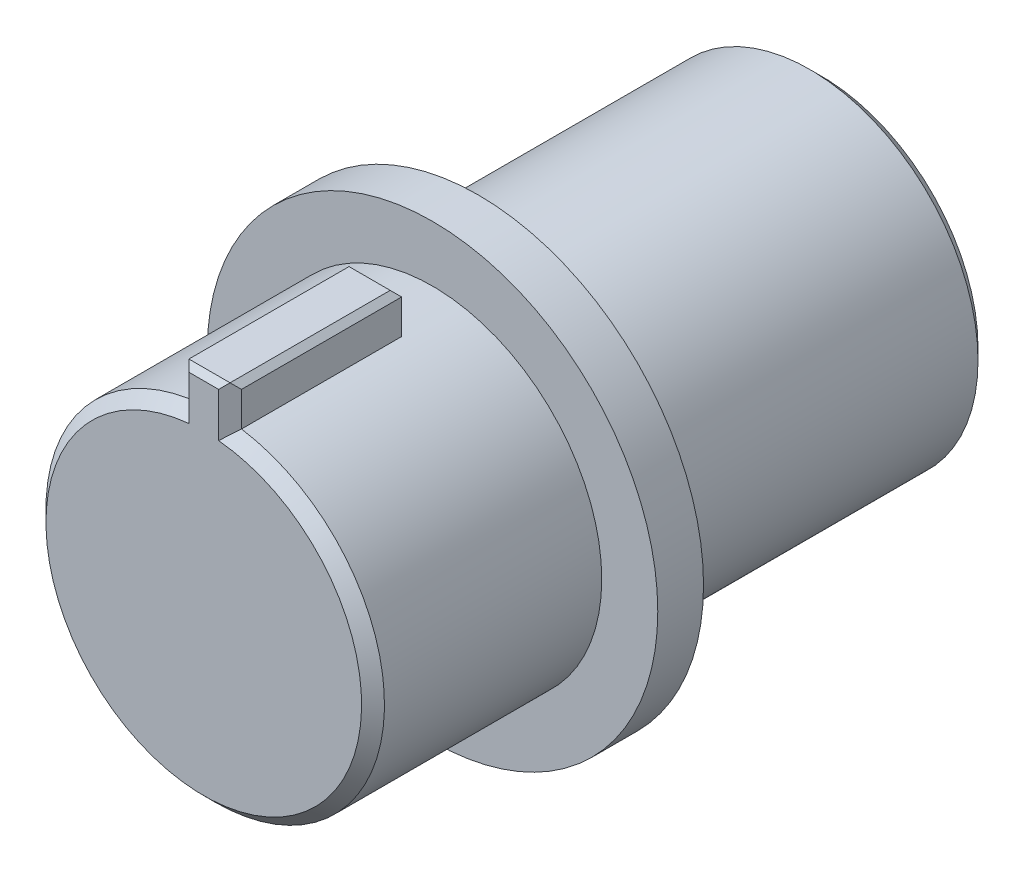
from build123d import *

# Parameters (mm, degrees)
SKETCH1_R           = 14.7
BOSS_EXTRUDE1_DEPTH = 30
SKETCH2_R           = 19.7
BOSS_EXTRUDE2_DEPTH = 4
SKETCH3_R           = 14.8
BOSS_EXTRUDE3_DEPTH = 20
BOSS_EXTRUDE4_START = -15
BOSS_EXTRUDE4_DEPTH = 15
CHAMFER1_SIZE       = 0.5
CHAMFER2_SIZE       = 1


with BuildPart() as part:
    # Sketch1 → Boss-Extrude1 (new body)
    with BuildSketch(Plane.XY):
        with Locations((-50, 10.3)):
            Circle(SKETCH1_R)
    extrude(amount=-BOSS_EXTRUDE1_DEPTH)

    # Sketch2 → Boss-Extrude2 (add)
    with BuildSketch(Plane.XY):
        with Locations((-50, 10.3)):
            Circle(SKETCH2_R)
    extrude(amount=BOSS_EXTRUDE2_DEPTH)

    # Sketch3 → Boss-Extrude3 (add)
    with BuildSketch(Plane.XY.offset(4)):
        with Locations((-50, 10.3)):
            Circle(SKETCH3_R)
    extrude(amount=BOSS_EXTRUDE3_DEPTH)

    # Sketch5 → Boss-Extrude4 (add)
    with BuildSketch(Plane.XY.offset(24).offset(BOSS_EXTRUDE4_START)):
        with BuildLine():
            Line((-52.3, 24.920191517), (-52.3, 28.420191517))
            Line((-52.3, 28.420191517), (-47.7, 28.420191517))
            Line((-47.7, 28.420191517), (-47.7, 24.920191517))
            ThreePointArc((-47.7, 24.920191517), (-50, 25.1), (-52.3, 24.920191517))
        make_face()
    extrude(amount=BOSS_EXTRUDE4_DEPTH)

    # Chamfer1
    chamfer1_edges = [part.edges().sort_by_distance(p)[0] for p in [
        (-50, 28.420191517, 9),
        (-52.3, 28.420191517, 16.5),
        (-47.7, 28.420191517, 16.5),
        (-50, 28.420191517, 24),
    ]]
    chamfer(chamfer1_edges, length=CHAMFER1_SIZE)

    # Chamfer2
    chamfer2_edges = [part.edges().sort_by_distance(p)[0] for p in [
        (-47.7, 26.420191517, 24),
        (-52.3, 26.420191517, 24),
        (-59.617692031, -0.948999956, 24),
        (-64.7, 10.3, -30),
    ]]
    chamfer(chamfer2_edges, length=CHAMFER2_SIZE - 0.0001)  # a hair under: the kernel refuses the full size


solid = part.part
